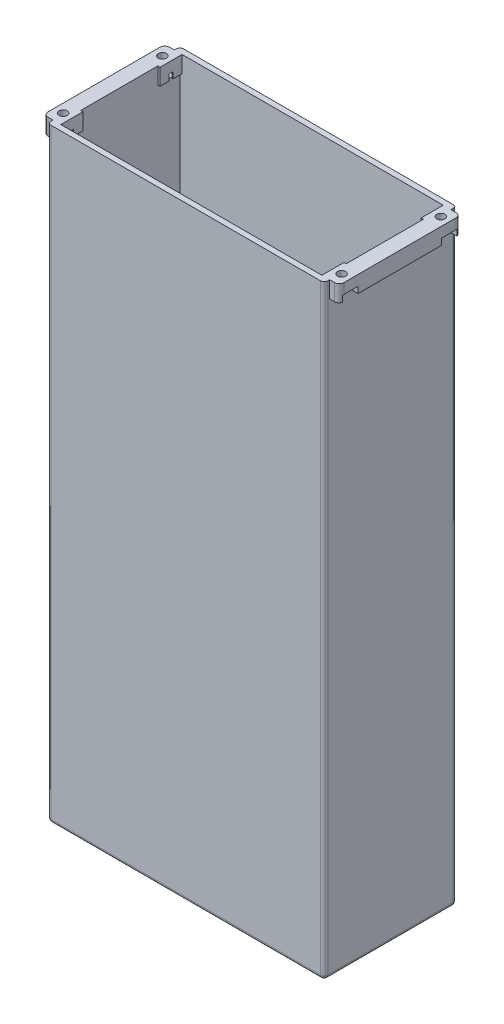
from build123d import *

# Parameters (mm, degrees)
SKETCH_1_W          = 72
SKETCH_1_H          = 32.9
EXTRUDE_1_DEPTH     = 162.5
SHELL_1_T           = 1.5
FILLET_2_R          = 1
EXTRUDE_2_DEPTH     = 4.5
SKETCH_8_R          = 1.1
CUT_EXTRUDE_3_DEPTH = 5
CUT_EXTRUDE_4_DEPTH = 1.7
FILLET_3_R          = 1.25
SKETCH_11_W         = 0.5
SKETCH_11_H         = 1
CUT_EXTRUDE_5_DEPTH = 1.7
FILLET_4_R          = 0.2
FILLET_5_R          = 0.1


with BuildPart() as part:
    # 草图1 → 凸台-拉伸1 (new body)
    with BuildSketch(Plane(origin=(0, 0, 0), x_dir=(1, 0, 0), z_dir=(0, 1, 0))):
        with Locations((36, 16.45)):
            Rectangle(SKETCH_1_W, SKETCH_1_H)
    extrude(amount=EXTRUDE_1_DEPTH)

    # 抽壳1
    shell_1_openings = [part.faces().sort_by_distance(p)[0] for p in [
        (36, 162.5, -16.45),
    ]]
    offset(amount=SHELL_1_T, openings=shell_1_openings, kind=Kind.INTERSECTION)

    # 圆角2
    # the kernel refuses this fillet: 1 mm, written as the material it takes off along each edge
    with BuildSketch(Plane(origin=(72.5, -0.5, -33.4), x_dir=(0, -1, 0), z_dir=(0, 0, -1))) as fillet_2_piece_1_section:
        Polygon((0, 0), (FILLET_2_R, 0), (FILLET_2_R, -FILLET_2_R), (0, -FILLET_2_R), align=None)
    fillet_2_piece_1 = extrude(amount=FILLET_2_R, mode=Mode.PRIVATE)
    fillet_2_piece_1 = fillet_2_piece_1 - Plane(origin=(72.5, -0.5, -33.4), x_dir=(-0.7071067811865475, 0.7071067811865475, 0), z_dir=(0, 0, -1)) * Sphere(FILLET_2_R, mode=Mode.PRIVATE)
    add(fillet_2_piece_1, mode=Mode.SUBTRACT)
    with BuildSketch(Plane(origin=(-0.5, -0.5, -33.4), x_dir=(-1, 0, 0), z_dir=(0, 0, -1))) as fillet_2_piece_2_section:
        Polygon((0, 0), (FILLET_2_R, 0), (FILLET_2_R, -FILLET_2_R), (0, -FILLET_2_R), align=None)
    fillet_2_piece_2 = extrude(amount=FILLET_2_R, mode=Mode.PRIVATE)
    fillet_2_piece_2 = fillet_2_piece_2 - Plane(origin=(-0.5, -0.5, -33.4), x_dir=(0.7071067811865475, 0.7071067811865475, 0), z_dir=(0, 0, -1)) * Sphere(FILLET_2_R, mode=Mode.PRIVATE)
    add(fillet_2_piece_2, mode=Mode.SUBTRACT)
    with BuildSketch(Plane(origin=(72.5, -0.5, 0.5), x_dir=(0, 0, 1), z_dir=(0, -1, 0))) as fillet_2_piece_3_section:
        Polygon((0, 0), (FILLET_2_R, 0), (FILLET_2_R, -FILLET_2_R), (0, -FILLET_2_R), align=None)
    fillet_2_piece_3 = extrude(amount=FILLET_2_R, mode=Mode.PRIVATE)
    fillet_2_piece_3 = fillet_2_piece_3 - Plane(origin=(72.5, -0.5, 0.5), x_dir=(-0.7071067811865475, 0, -0.7071067811865475), z_dir=(0, -1, 0)) * Sphere(FILLET_2_R, mode=Mode.PRIVATE)
    add(fillet_2_piece_3, mode=Mode.SUBTRACT)
    with BuildSketch(Plane(origin=(-0.5, -0.5, 0.5), x_dir=(0, -1, 0), z_dir=(-1, 0, 0))) as fillet_2_piece_4_section:
        Polygon((0, 0), (FILLET_2_R, 0), (FILLET_2_R, FILLET_2_R), (0, FILLET_2_R), align=None)
    fillet_2_piece_4 = extrude(amount=FILLET_2_R, mode=Mode.PRIVATE)
    fillet_2_piece_4 = fillet_2_piece_4 - Plane(origin=(-0.5, -0.5, 0.5), x_dir=(0, 0.7071067811865475, -0.7071067811865475), z_dir=(-1, 0, 0)) * Sphere(FILLET_2_R, mode=Mode.PRIVATE)
    add(fillet_2_piece_4, mode=Mode.SUBTRACT)
    with BuildSketch(Plane(origin=(72.5, -1.5, -34.4), x_dir=(0, 1, 0), z_dir=(-1, 0, 0)), Plane(origin=(-0.5, -1.5, 1.5), x_dir=(0, 1, 0), z_dir=(1, 0, 0))) as fillet_2_piece_5:
        with BuildLine():
            CenterArc((FILLET_2_R, -FILLET_2_R), FILLET_2_R, 90, 90)
            Line((0, -FILLET_2_R), (0, 0))
            Line((0, 0), (FILLET_2_R, 0))
        make_face()
    extrude(amount=73, mode=Mode.SUBTRACT)
    with BuildSketch(Plane(origin=(73.5, -1.5, 0.5), x_dir=(0, 1, 0), z_dir=(0, 0, -1)), Plane(origin=(-1.5, -1.5, -33.4), x_dir=(0, 1, 0), z_dir=(0, 0, 1))) as fillet_2_piece_6:
        with BuildLine():
            CenterArc((FILLET_2_R, -FILLET_2_R), FILLET_2_R, 90, 90)
            Line((0, -FILLET_2_R), (0, 0))
            Line((0, 0), (FILLET_2_R, 0))
        make_face()
    extrude(amount=33.9, mode=Mode.SUBTRACT)
    with BuildSketch(Plane(origin=(-1.5, -0.5, -34.4), x_dir=(1, 0, 0), z_dir=(0, 1, 0)), Plane(origin=(73.5, -0.5, -34.4), x_dir=(0, 0, 1), z_dir=(0, 1, 0)), Plane(origin=(73.5, -0.5, 1.5), x_dir=(-1, 0, 0), z_dir=(0, 1, 0)), Plane(origin=(-1.5, 165, 1.5), x_dir=(1, 0, 0), z_dir=(0, -1, 0))) as fillet_2_piece_7:
        with BuildLine():
            CenterArc((FILLET_2_R, -FILLET_2_R), FILLET_2_R, 90, 90)
            Line((0, -FILLET_2_R), (0, 0))
            Line((0, 0), (FILLET_2_R, 0))
        make_face()
    extrude(amount=165.5, mode=Mode.SUBTRACT)

    # 草图2 → 凸台-拉伸2 (add)
    with BuildSketch(Plane(origin=(0, 162.5, 0), x_dir=(1, 0, 0), z_dir=(0, 1, 0))):
        Polygon((-1.5, 6), (-1.5, 26.9), (0.6, 26.9), (0.6, 32.9), (-4.1, 32.9), (-4.1, 26.9), (-4.1, 6), (-4.1, 0), (0.6, 0), (0.6, 6), align=None)
        Polygon((73.5, 26.9), (73.5, 6), (71.4, 6), (71.4, 0), (76.1, 0), (76.1, 6), (76.1, 26.9), (76.1, 32.9), (71.4, 32.9), (71.4, 26.9), align=None)
    extrude(amount=-EXTRUDE_2_DEPTH)

    # 草图8 → 切除-拉伸3 (cut)
    with BuildSketch(Plane(origin=(0, 162.5, 0), x_dir=(1, 0, 0), z_dir=(0, 1, 0))):
        with Locations(Location((-1.75, 29.9, 0), (0, 0, 270))):
            Circle(SKETCH_8_R)
        with Locations(Location((73.75, 29.9, 0), (0, 0, 256.863441213))):
            Circle(SKETCH_8_R)
        with Locations(Location((73.75, 3, 0), (0, 0, 270))):
            Circle(SKETCH_8_R)
        with Locations(Location((-1.75, 3, 0), (0, 0, 283.136558787))):
            Circle(SKETCH_8_R)
    extrude(amount=-CUT_EXTRUDE_3_DEPTH, mode=Mode.SUBTRACT)

    # 草图10 → 切除-拉伸4 (cut)
    with BuildSketch(Plane.XZ.offset(-158)):
        Polygon((-2.360902354, -27.8), (-4.325128869, -27.8), (-4.325128869, -32), (-2.477398874, -32), (-0.537564435, -32), (0.674871131, -29.9), (-0.537564435, -27.8), align=None)
        Polygon((76.325128869, -27.8), (76.325128869, -32), (74.477398874, -32), (72.537564435, -32), (71.325128869, -29.9), (72.537564435, -27.8), (74.360902354, -27.8), align=None)
        Polygon((-4.325128869, -5.1), (-4.325128869, -0.9), (-2.477398874, -0.9), (-0.537564435, -0.9), (0.674871131, -3), (-0.537564435, -5.1), (-2.360902354, -5.1), align=None)
        Polygon((74.360902354, -5.1), (76.325128869, -5.1), (76.325128869, -0.9), (74.477398874, -0.9), (72.537564435, -0.9), (71.325128869, -3), (72.537564435, -5.1), align=None)
    extrude(amount=-CUT_EXTRUDE_4_DEPTH, mode=Mode.SUBTRACT)

    # 圆角3
    fillet_3_edges = [part.edges().sort_by_distance(p)[0] for p in [
        (76.1, 160.25, -32.9),
        (76.1, 160.25, 0),
        (-4.1, 160.25, 0),
        (-4.1, 160.25, -32.9),
    ]]
    fillet(fillet_3_edges, radius=FILLET_3_R)

    # 草图11 → 切除-拉伸5 (cut)
    with BuildSketch(Plane.XZ.offset(-158)):
        with Locations((0.55, -3)):
            Rectangle(SKETCH_11_W, SKETCH_11_H)
        with Locations((71.45, -3)):
            Rectangle(SKETCH_11_W, SKETCH_11_H)
        with Locations((71.45, -29.9)):
            Rectangle(SKETCH_11_W, SKETCH_11_H)
        with Locations((0.55, -29.9)):
            Rectangle(SKETCH_11_W, SKETCH_11_H)
    extrude(amount=-CUT_EXTRUDE_5_DEPTH, mode=Mode.SUBTRACT)

    # 圆角4
    fillet_4_edges = [part.edges().sort_by_distance(p)[0] for p in [
        (72, 158, -31.984455543),
        (72, 158, -5.084455543),
        (72, 158, -0.915544457),
        (72, 158, -27.815544457),
        (0, 158, -0.915544457),
        (0, 158, -27.815544457),
        (0, 158, -31.984455543),
        (0, 158, -5.084455543),
    ]]
    fillet(fillet_4_edges, radius=FILLET_4_R)

    # 圆角5
    fillet_5_edges = [part.edges().sort_by_distance(p)[0] for p in [
        (0, 157.9, -28.731088913),
        (0, 157.9, -31.068911087),
        (0, 157.9, -4.168911087),
        (0, 157.9, -1.831088913),
        (72, 157.9, -4.168911087),
        (72, 157.9, -1.831088913),
        (72, 157.9, -28.731088913),
        (72, 157.9, -31.068911087),
    ]]
    fillet(fillet_5_edges, radius=FILLET_5_R)


solid = part.part
